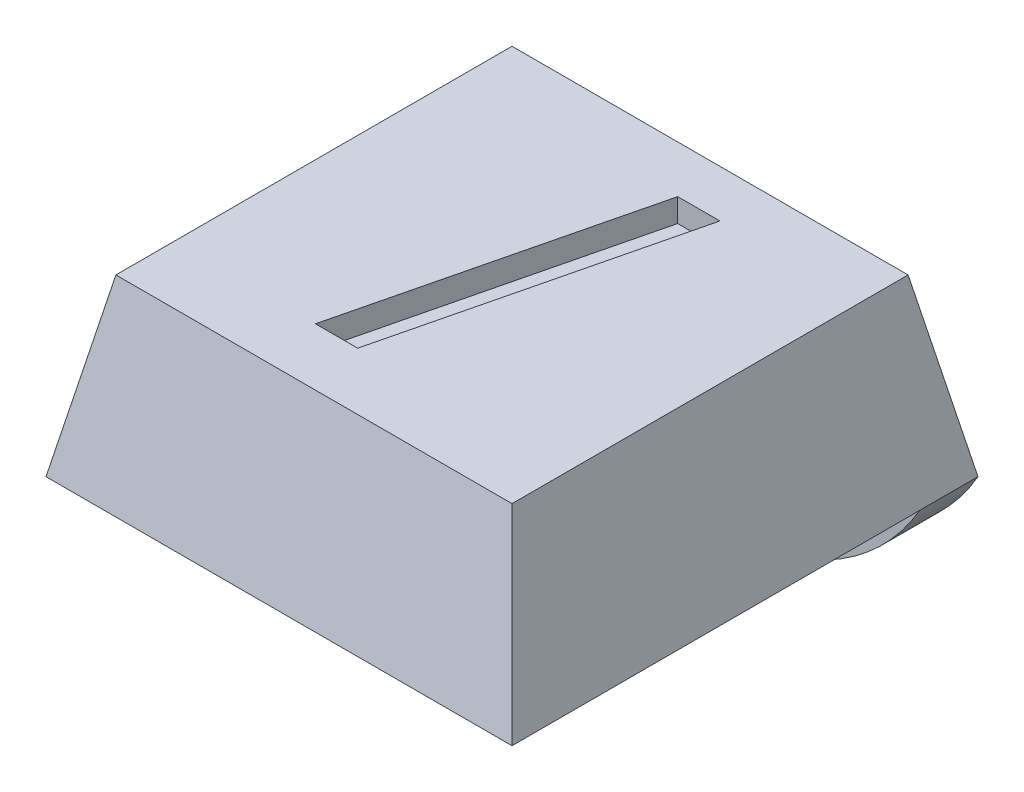
from build123d import *

# Parameters (mm, degrees)
SKETCH1_W               = 8
SKETCH1_H               = 8
BOSS_EXTRUDE1_DEPTH     = 3
CUT_EXTRUDE1_DEPTH      = 12.704699911
CUT_EXTRUDE1_DEPTH_BACK = 12.704699911
CUT_EXTRUDE2_DEPTH      = 11
SKETCH4_R               = 1.75
CUT_EXTRUDE3_DEPTH      = 0.4
SKETCH5_W               = 8
SKETCH5_H               = 1
BOSS_EXTRUDE2_DEPTH     = 2
FILLET1_R               = 4
CUT_EXTRUDE4_DEPTH      = 0.4


with BuildPart() as part:
    # Sketch1 → Boss-Extrude1 (new body)
    with BuildSketch(Plane(origin=(0, 0, 0), x_dir=(1, 0, 0), z_dir=(0, 1, 0))):
        with Locations((4, 4)):
            Rectangle(SKETCH1_W, SKETCH1_H)
    extrude(amount=BOSS_EXTRUDE1_DEPTH)

    # Sketch2 → Cut-Extrude1 (cut, two sides: drawn at the far end of the back side and taken through both)
    with BuildSketch(Plane.XY.offset(-CUT_EXTRUDE1_DEPTH_BACK)):
        Polygon((0, 0), (0.6, 3), (0, 3), align=None)
        Polygon((8, 0), (7.4, 3), (8, 3), align=None)
    extrude(amount=CUT_EXTRUDE1_DEPTH + CUT_EXTRUDE1_DEPTH_BACK, mode=Mode.SUBTRACT)

    # Sketch3 → Cut-Extrude2 (cut)
    with BuildSketch(Plane(origin=(0, 0, 0), x_dir=(0, 0, -1), z_dir=(1, 0, 0))):
        Polygon((0, 0), (0.6, 3), (0, 3), align=None)
        Polygon((8, 3), (7.4, 3), (8, 0), align=None)
    extrude(amount=CUT_EXTRUDE2_DEPTH, mode=Mode.SUBTRACT)

    # Sketch4 → Cut-Extrude3 (cut)
    with BuildSketch(Plane.XZ):
        with Locations(Location((4, -3.75, 0), (0, 0, 270))):
            Circle(SKETCH4_R)
    extrude(amount=-CUT_EXTRUDE3_DEPTH, mode=Mode.SUBTRACT)

    # Sketch5 → Boss-Extrude2 (add)
    with BuildSketch(Plane.XZ):
        with Locations((4, -7.5)):
            Rectangle(SKETCH5_W, SKETCH5_H)
    extrude(amount=BOSS_EXTRUDE2_DEPTH)

    # Fillet1
    # the kernel refuses this fillet: 4 mm, written as the material it takes off along each edge
    with BuildSketch(Plane(origin=(8, -2, -16.660254038), x_dir=(0, 1, 0), z_dir=(0, 0, 1)), Plane(origin=(0, -2, 1.660254038), x_dir=(0, 1, 0), z_dir=(0, 0, -1))) as fillet1_piece_1:
        with BuildLine():
            CenterArc((4, 3.464101615), FILLET1_R, 180, 60)
            Line((0, 3.464101615), (-0.08, 3.464101615))
            Line((-0.08, 3.464101615), (-0.08, 0))
            Line((-0.08, 0), (0, -0.08))
            ThreePointArc((0, -0.08), (1, -0.08), (1.96, -0.069282032))
            Line((1.96, -0.069282032), (2, 0))
        make_face()
    extrude(amount=18.320508076, mode=Mode.SUBTRACT)

    # Sketch6 → Cut-Extrude4 (cut)
    with BuildSketch(Plane(origin=(0, 3, 0), x_dir=(1, 0, 0), z_dir=(0, 1, 0))):
        Polygon((3.039241423, 1.586469201), (4.258191744, 6.586469201), (4.982350398, 6.586469201), (3.76440168, 1.586469201), align=None)
    extrude(amount=-CUT_EXTRUDE4_DEPTH, mode=Mode.SUBTRACT)


solid = part.part
